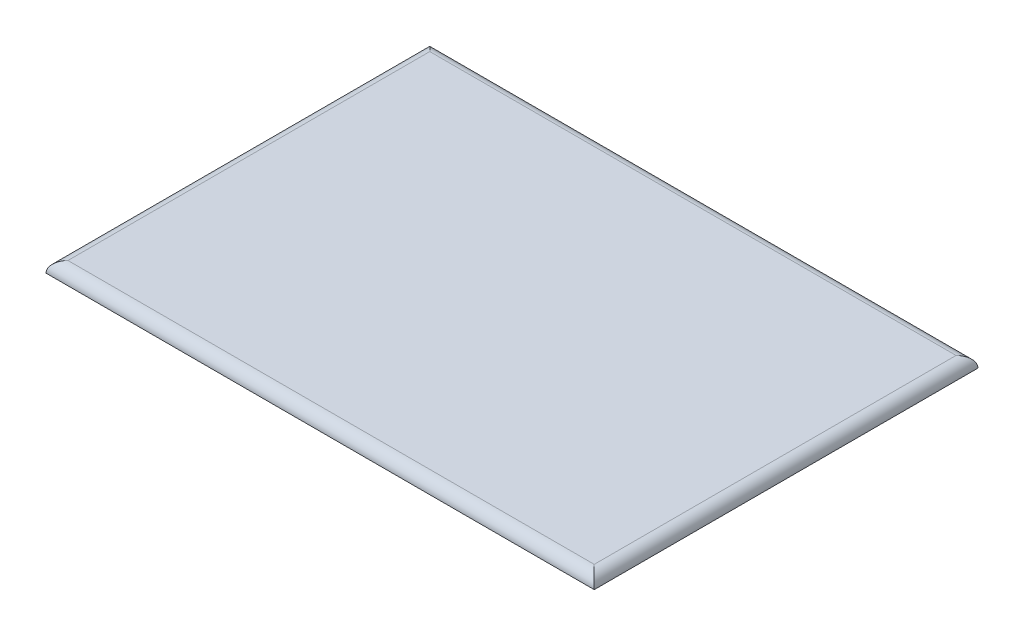
from build123d import *

# Parameters (mm, degrees)
SKETCH2_W           = 100
SKETCH2_H           = 70
BOSS_EXTRUDE1_DEPTH = 2
FILLET1_R           = 2


with BuildPart() as part:
    # Sketch2 → Boss-Extrude1 (new body)
    with BuildSketch(Plane(origin=(0, 0, 0), x_dir=(1, 0, 0), z_dir=(0, 1, 0))):
        Rectangle(SKETCH2_W, SKETCH2_H)
    extrude(amount=BOSS_EXTRUDE1_DEPTH)

    # Fillet1
    fillet1_edges = [part.edges().sort_by_distance(p)[0] for p in [
        (0, 2, -35),
        (50, 2, 0),
        (0, 2, 35),
        (-50, 2, 0),
    ]]
    fillet(fillet1_edges, radius=FILLET1_R - 0.0001)  # a hair under: the kernel refuses the full size


solid = part.part
